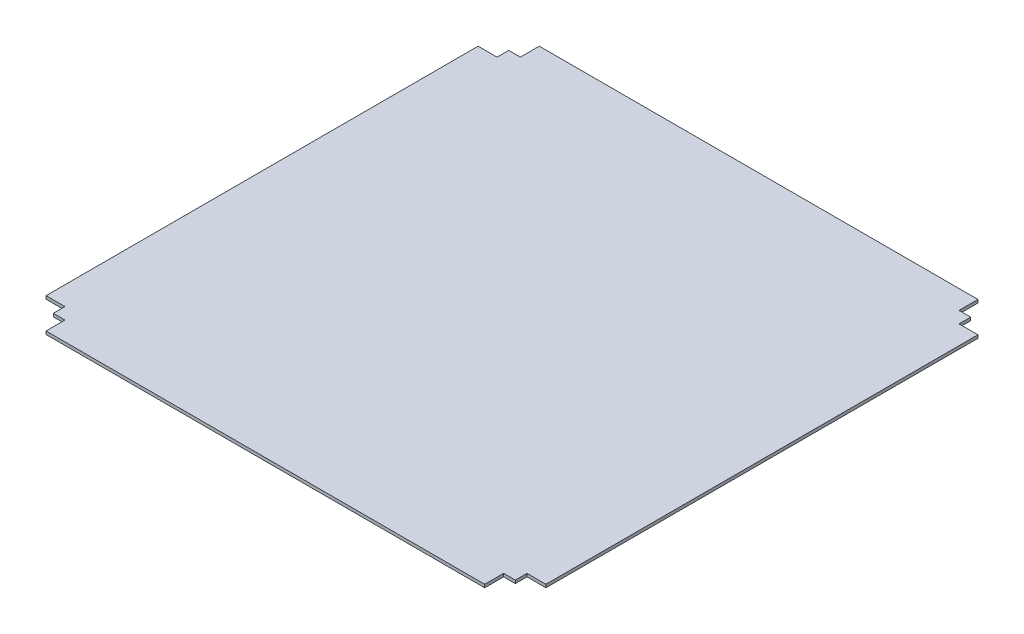
from build123d import *

# Parameters (mm, degrees)
SKETCH1_W           = 514.5
SKETCH1_H           = 507.75
BOSS_EXTRUDE1_DEPTH = 3.175
CAVITY1_START       = -252
CAVITY1_OUTLINE_W   = 29.625
CAVITY1_OUTLINE_H   = 3.175
CAVITY1_DEPTH       = 17.625
CAVITY1_START_2     = 222.375
CAVITY1_2_OUTLINE_W = 17.625
CAVITY1_2_OUTLINE_H = 3.175
CAVITY1_2_DEPTH     = 29.625
CAVITY1_START_3     = -234.375
CAVITY1_3_OUTLINE_W = 17.625
CAVITY1_3_OUTLINE_H = 3.175
CAVITY1_3_DEPTH     = 12
CAVITY1_START_4     = 234.375
CAVITY1_4_OUTLINE_W = 12
CAVITY1_4_OUTLINE_H = 3.175
CAVITY1_4_DEPTH     = 17.625
CAVITY1_5_OUTLINE_W = 1.8375
CAVITY1_5_OUTLINE_H = 3.175
CAVITY1_5_DEPTH     = 14.625
CAVITY1_START_5     = 237.375
CAVITY1_6_OUTLINE_W = 1.8375
CAVITY1_6_OUTLINE_H = 3.175
CAVITY1_6_DEPTH     = 14.625
SKETCH2_W           = 12
SKETCH2_H           = 19.5
CUT_EXTRUDE1_DEPTH  = 362.441777815


# Read off the part's stored shape, not the designer's step: Cavity1
with BuildPart() as part:
    # Sketch1 → Boss-Extrude1 (new body)
    with BuildSketch(Plane(origin=(0, 0, 0), x_dir=(1, 0, 0), z_dir=(0, 1, 0))):
        Rectangle(SKETCH1_W, SKETCH1_H)
    extrude(amount=BOSS_EXTRUDE1_DEPTH)

    # Cavity1 outline → Cavity1 (cut)
    with BuildSketch(Plane.XY.offset(CAVITY1_START)):
        with Locations((-240.6, 1.5875)):
            Rectangle(CAVITY1_OUTLINE_W, CAVITY1_OUTLINE_H)
        with Locations((240.6, 1.5875)):
            Rectangle(CAVITY1_OUTLINE_W, CAVITY1_OUTLINE_H)
    extrude(amount=CAVITY1_DEPTH, mode=Mode.SUBTRACT)

    # Cavity1 2 outline → Cavity1 2 (cut)
    with BuildSketch(Plane.XY.offset(CAVITY1_START_2)):
        with Locations((-246.6, 1.5875)):
            Rectangle(CAVITY1_2_OUTLINE_W, CAVITY1_2_OUTLINE_H)
        with Locations((246.6, 1.5875)):
            Rectangle(CAVITY1_2_OUTLINE_W, CAVITY1_2_OUTLINE_H)
    extrude(amount=CAVITY1_2_DEPTH, mode=Mode.SUBTRACT)

    # Cavity1 3 outline → Cavity1 3 (cut)
    with BuildSketch(Plane.XY.offset(CAVITY1_START_3)):
        with Locations((-246.6, 1.5875)):
            Rectangle(CAVITY1_3_OUTLINE_W, CAVITY1_3_OUTLINE_H)
        with Locations((246.6, 1.5875)):
            Rectangle(CAVITY1_3_OUTLINE_W, CAVITY1_3_OUTLINE_H)
    extrude(amount=CAVITY1_3_DEPTH, mode=Mode.SUBTRACT)

    # Cavity1 4 outline → Cavity1 4 (cut)
    with BuildSketch(Plane.XY.offset(CAVITY1_START_4)):
        with Locations((-231.7875, 1.5875)):
            Rectangle(CAVITY1_4_OUTLINE_W, CAVITY1_4_OUTLINE_H)
        with Locations((231.7875, 1.5875)):
            Rectangle(CAVITY1_4_OUTLINE_W, CAVITY1_4_OUTLINE_H)
    extrude(amount=CAVITY1_4_DEPTH, mode=Mode.SUBTRACT)

    # Cavity1 5 outline → Cavity1 5 (cut)
    with BuildSketch(Plane.XY.offset(CAVITY1_START)):
        with Locations((-256.33125, 1.5875)):
            Rectangle(CAVITY1_5_OUTLINE_W, CAVITY1_5_OUTLINE_H)
        with Locations((256.33125, 1.5875)):
            Rectangle(CAVITY1_5_OUTLINE_W, CAVITY1_5_OUTLINE_H)
    extrude(amount=CAVITY1_5_DEPTH, mode=Mode.SUBTRACT)

    # Cavity1 6 outline → Cavity1 6 (cut)
    with BuildSketch(Plane.XY.offset(CAVITY1_START_5)):
        with Locations((-256.33125, 1.5875)):
            Rectangle(CAVITY1_6_OUTLINE_W, CAVITY1_6_OUTLINE_H)
        with Locations((256.33125, 1.5875)):
            Rectangle(CAVITY1_6_OUTLINE_W, CAVITY1_6_OUTLINE_H)
    extrude(amount=CAVITY1_6_DEPTH, mode=Mode.SUBTRACT)

    # Sketch2 → Cut-Extrude1 (cut, through all)
    with BuildSketch(Plane(origin=(0, 3.175, 0), x_dir=(1, 0, 0), z_dir=(0, 1, 0))):
        Polygon((-237.7875, -234.375), (-237.7875, -222.375), (-257.25, -222.375), (-257.25, -253.875), (-237.7875, -253.875), align=None)
        with Locations((-231.7875, -244.125)):
            Rectangle(SKETCH2_W, SKETCH2_H)
        Polygon((257.25, -222.375), (237.7875, -222.375), (237.7875, -234.375), (237.7875, -253.875), (257.25, -253.875), align=None)
        with Locations((231.7875, -244.125)):
            Rectangle(SKETCH2_W, SKETCH2_H)
        Polygon((237.7875, 234.375), (237.7875, 222.375), (257.25, 222.375), (257.25, 253.875), (237.7875, 253.875), align=None)
        with Locations((231.7875, 244.125)):
            Rectangle(SKETCH2_W, SKETCH2_H)
        Polygon((-257.25, 222.375), (-237.7875, 222.375), (-237.7875, 234.375), (-237.7875, 253.875), (-257.25, 253.875), align=None)
        with Locations((-231.7875, 244.125)):
            Rectangle(SKETCH2_W, SKETCH2_H)
    extrude(amount=-CUT_EXTRUDE1_DEPTH, mode=Mode.SUBTRACT)


solid = part.part
